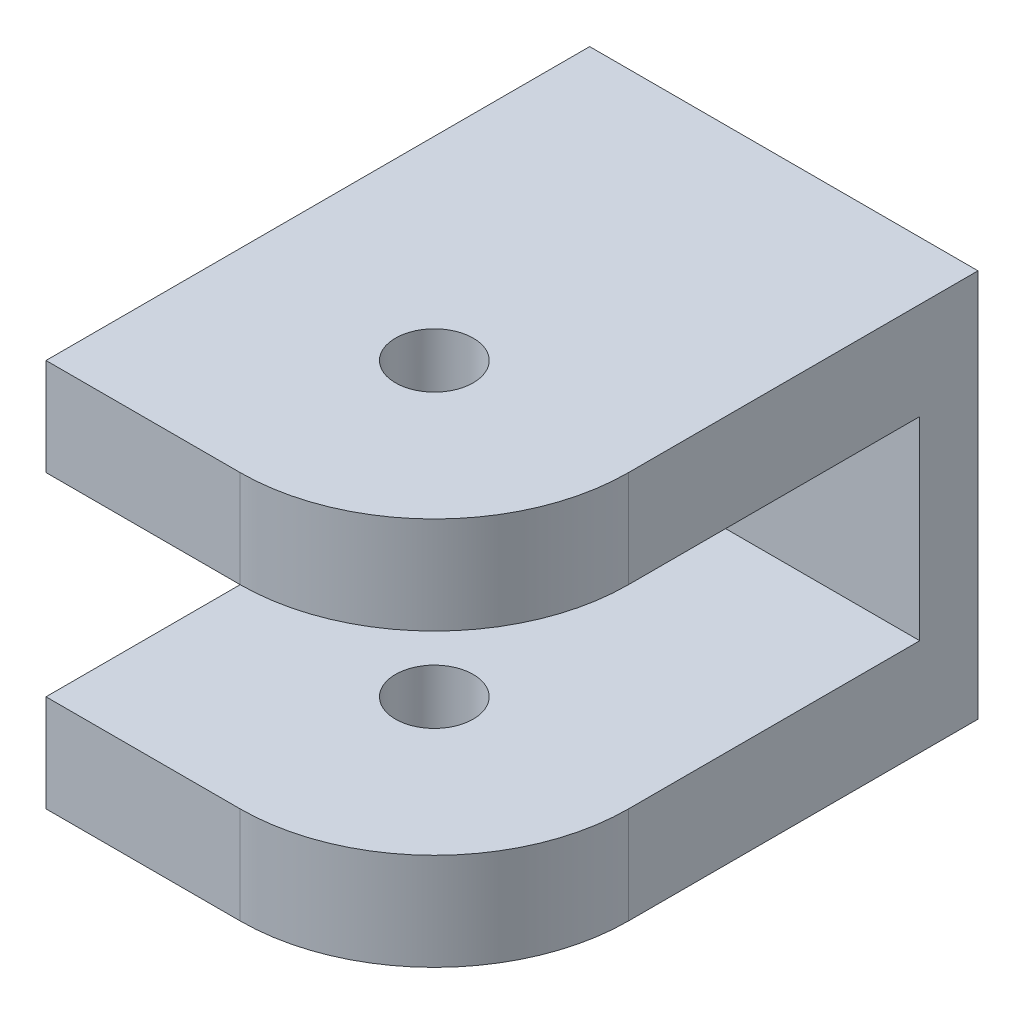
from build123d import *

# Parameters (mm, degrees)
CROQUIS1_W              = 20
CROQUIS1_H              = 20
CROQUIS1_R              = 1.55
SALIENTE_EXTRUIR1_DEPTH = 3
CROQUIS2_W              = 20
CROQUIS2_H              = 5
SALIENTE_EXTRUIR3_DEPTH = 15
SALIENTE_EXTRUIR4_DEPTH = 5
SALIENTE_EXTRUIR5_START = -5
SALIENTE_EXTRUIR5_DEPTH = 5
CROQUIS5_R              = 2
CORTAR_EXTRUIR1_DEPTH   = 38.749172176


with BuildPart() as part:
    # Croquis1 → Saliente-Extruir1 (new body)
    with BuildSketch(Plane.XY):
        with Locations((10, 10)):
            Rectangle(CROQUIS1_W, CROQUIS1_H)
        with Locations((10, 10)):
            Circle(CROQUIS1_R, mode=Mode.SUBTRACT)
    extrude(amount=-SALIENTE_EXTRUIR1_DEPTH)

    # Croquis2 → Saliente-Extruir3 (add)
    with BuildSketch(Plane.XY):
        with Locations((10, 2.5)):
            Rectangle(CROQUIS2_W, CROQUIS2_H)
        with Locations((10, 17.5)):
            Rectangle(CROQUIS2_W, CROQUIS2_H)
    extrude(amount=SALIENTE_EXTRUIR3_DEPTH)

    # Croquis3 → Saliente-Extruir4 (add)
    with BuildSketch(Plane(origin=(0, 20, 0), x_dir=(1, 0, 0), z_dir=(0, 1, 0))):
        with BuildLine():
            Line((20, -15), (0, -15))
            Line((0, -15), (0, -25))
            Line((0, -25), (10, -25))
            ThreePointArc((10, -25), (17.071067812, -22.071067812), (20, -15))
        make_face()
    extrude(amount=-SALIENTE_EXTRUIR4_DEPTH)

    # Croquis4 → Saliente-Extruir5 (add)
    with BuildSketch(Plane.XZ.offset(SALIENTE_EXTRUIR5_START)):
        with BuildLine():
            Line((0, 15), (20, 15))
            ThreePointArc((20, 15), (17.071067812, 22.071067812), (10, 25))
            Line((10, 25), (0, 25))
            Line((0, 25), (0, 15))
        make_face()
    extrude(amount=SALIENTE_EXTRUIR5_DEPTH)

    # Croquis5 → Cortar-Extruir1 (cut, through all)
    with BuildSketch(Plane.XZ):
        with Locations((10, 15)):
            Circle(CROQUIS5_R)
    extrude(amount=-CORTAR_EXTRUIR1_DEPTH, mode=Mode.SUBTRACT)


solid = part.part
